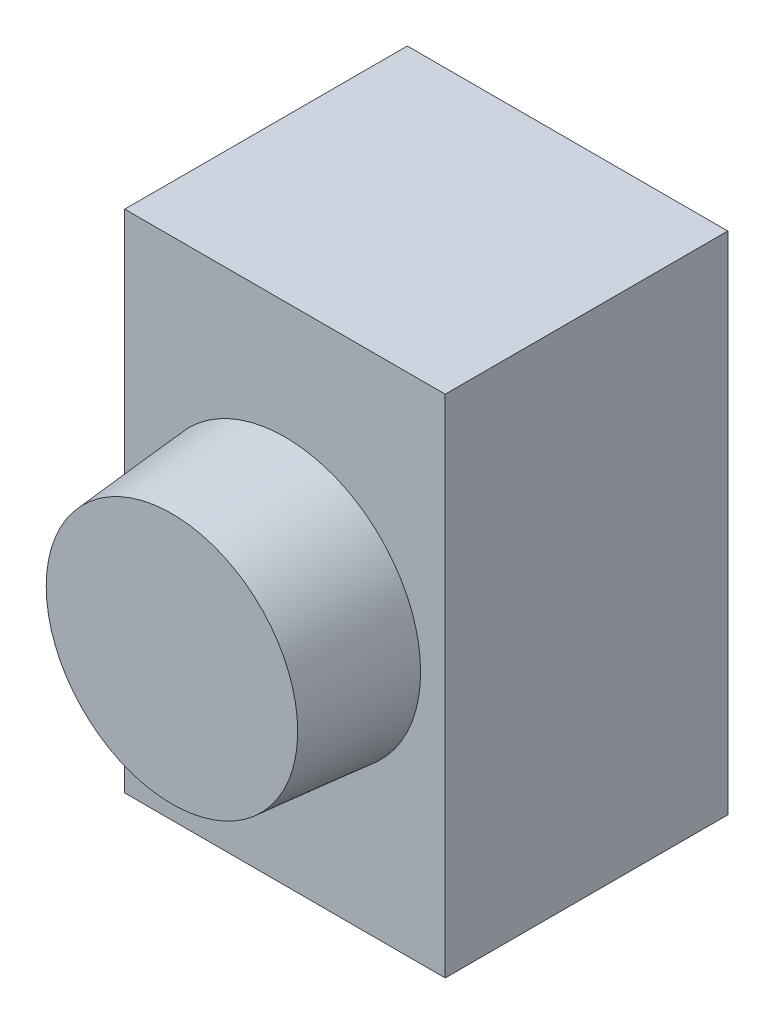
from build123d import *

# Parameters (mm, degrees)
SKETCH1_R           = 12
BOSS_EXTRUDE1_DEPTH = 10
BOSS_EXTRUDE1_TAPER = 5
SKETCH2_W           = 28.354647268
SKETCH2_H           = 44.733625866
BOSS_EXTRUDE2_DEPTH = 25


with BuildPart() as part:
    # Sketch1 → Boss-Extrude1 (new body)
    with BuildSketch(Plane.XY):
        Circle(SKETCH1_R)
    extrude(amount=BOSS_EXTRUDE1_DEPTH, taper=BOSS_EXTRUDE1_TAPER)

    # Sketch2 → Boss-Extrude2 (add)
    with BuildSketch(Plane.XY):
        Rectangle(SKETCH2_W, SKETCH2_H)
    extrude(amount=-BOSS_EXTRUDE2_DEPTH)


solid = part.part
